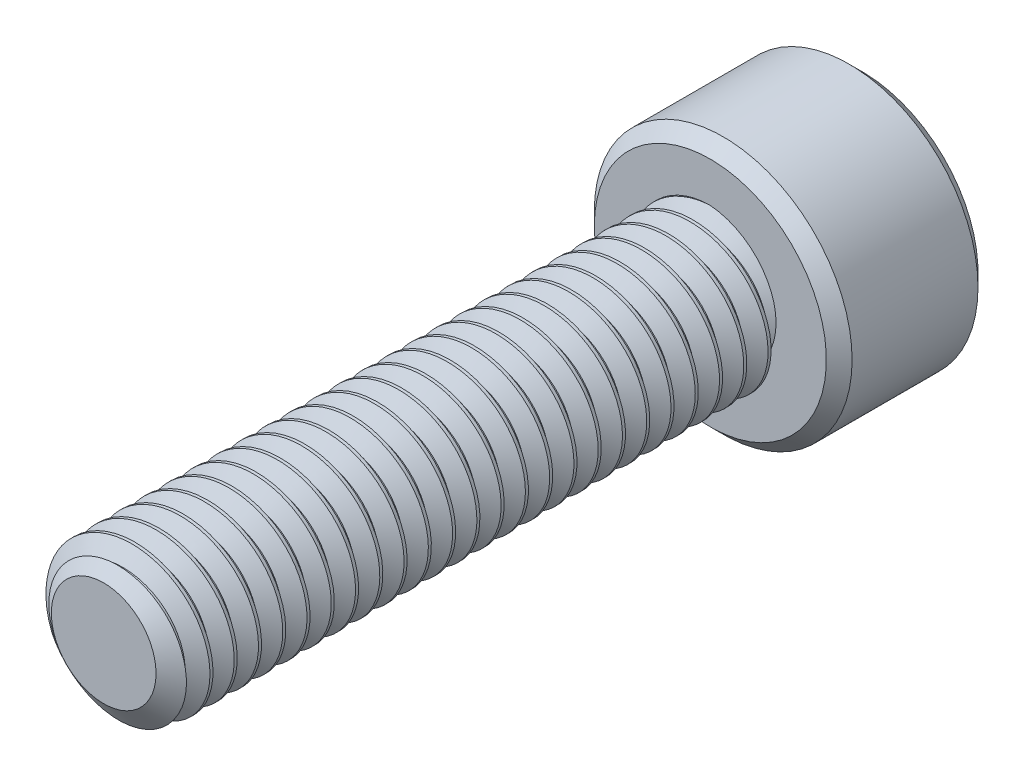
from build123d import *

# Parameters (mm, degrees)
SKETCH1_R          = 2.5
EXTRUDE1_DEPTH     = 20
CUT_SWEEP1_PITCH   = 0.8
SKETCH6_R          = 4.25
EXTRUDE2_DEPTH     = 5
CUT_EXTRUDE1_DEPTH = 3
CHAMFER1_SIZE      = 0.425


with BuildPart() as part:
    # Sketch1 → Extrude1 (new body)
    with BuildSketch(Plane.XY):
        Circle(SKETCH1_R)
    extrude(amount=-EXTRUDE1_DEPTH)

    # Cut-Sweep1: the profile of Sketch3 profile screwed along a right-hand helix of 26 turns, 6 arcs to a turn; built about Z, then put on its axis
    cut_sweep1_z = Axis((0, 0, 0), (0, 0, 1))
    cut_sweep1_corners = [(2.5003, 0, -0.700173205), (1.980384758, 0, -0.4), (1.980384758, 0, -0.3), (2.5003, 0, 0.000173205)]
    with BuildLine(mode=Mode.PRIVATE) as cut_sweep1_profile:
        Line(cut_sweep1_corners[0], cut_sweep1_corners[1])
        Line(cut_sweep1_corners[1], cut_sweep1_corners[2])
        Line(cut_sweep1_corners[2], cut_sweep1_corners[3])
        Line(cut_sweep1_corners[3], cut_sweep1_corners[0])
    cut_sweep1_cap = Face(cut_sweep1_profile.wire())
    cut_sweep1_turn_angles = [0, 30, 60, 90, 120, 150, 180, 210, 240, 270, 300, 330, 360]
    cut_sweep1_turn_weights = [1, 0.8660254037844387, 1, 0.8660254037844387, 1, 0.8660254037844387, 1, 0.8660254037844387, 1, 0.8660254037844387, 1, 0.8660254037844387, 1]
    cut_sweep1_turn_rails = [Edge.make_bspline([Vector(p[0], p[1], 0).rotate(cut_sweep1_z, cut_sweep1_turn_angles[k]) / cut_sweep1_turn_weights[k] + Vector(0, 0, p[2] + CUT_SWEEP1_PITCH * cut_sweep1_turn_angles[k] / 360) for k in range(13)], [0, 0, 0, 1, 1, 2, 2, 3, 3, 4, 4, 5, 5, 6, 6, 6], 2, cut_sweep1_turn_weights) for p in cut_sweep1_corners]
    cut_sweep1_turn_sides = [Face.make_surface_from_curves(cut_sweep1_turn_rails[p[0]], cut_sweep1_turn_rails[p[1]]) for p in [(0, 1), (1, 2), (2, 3), (3, 0)]]
    cut_sweep1 = Plane(origin=(0, 0, 0), x_dir=(0, 1, 0), z_dir=(0, 0, -1)) * Solid(Shell([*[p.moved(Location((0, 0, CUT_SWEEP1_PITCH * i))) for i in range(26) for p in cut_sweep1_turn_sides], cut_sweep1_cap, cut_sweep1_cap.rotate(cut_sweep1_z, 9360).moved(Location((0, 0, CUT_SWEEP1_PITCH * 9360 / 360)))]))
    add(cut_sweep1, mode=Mode.SUBTRACT)

    # Sketch4 → Cut-Revolve1 (revolve, cut)
    with BuildSketch(Plane(origin=(0, 0, 0), x_dir=(0, 0, -1), z_dir=(1, 0, 0)), mode=Mode.PRIVATE) as cut_revolve1_sk:
        Polygon((0.541691224, 2.5), (0, 1.726384758), (0, 2.5), align=None)
    revolve(cut_revolve1_sk.sketch.rotate(Axis((0, 0, 0), (0, 0, -1)), 260.43858876), axis=Axis((0, 0, 0), (0, 0, -1)), mode=Mode.SUBTRACT)

    # Sketch6 → Extrude2 (add)
    with BuildSketch(Plane(origin=(0, 0, -20), x_dir=(-1, 0, 0), z_dir=(0, 0, -1))):
        Circle(SKETCH6_R)
    extrude(amount=EXTRUDE2_DEPTH)

    # Sketch7 → Cut-Extrude1 (cut)
    with BuildSketch(Plane(origin=(0, 0, -25), x_dir=(-1, 0, 0), z_dir=(0, 0, -1))):
        Polygon((0, 2.309401077), (-2, 1.154700538), (-2, -1.154700538), (0, -2.309401077), (2, -1.154700538), (2, 1.154700538), align=None)
    extrude(amount=-CUT_EXTRUDE1_DEPTH, mode=Mode.SUBTRACT)

    # Cut-Extrude2 cone 1 section (through the dimple's axis) → Cut-Extrude2 (revolve, cut)
    with BuildSketch(Plane(origin=(0, 0, -25), x_dir=(0, 1, 0), z_dir=(1, 0, 0))):
        Polygon((0, 0), (2.309401077, 0), (0, 2.309401077), align=None)
    revolve(axis=Axis((0, 0, -25), (0, 0, 1)), mode=Mode.SUBTRACT)

    # Chamfer1
    chamfer1_edges = [part.edges().sort_by_distance(p)[0] for p in [
        (4.25, 0, -20),
        (4.25, 0, -25),
    ]]
    chamfer(chamfer1_edges, length=CHAMFER1_SIZE)


solid = part.part
